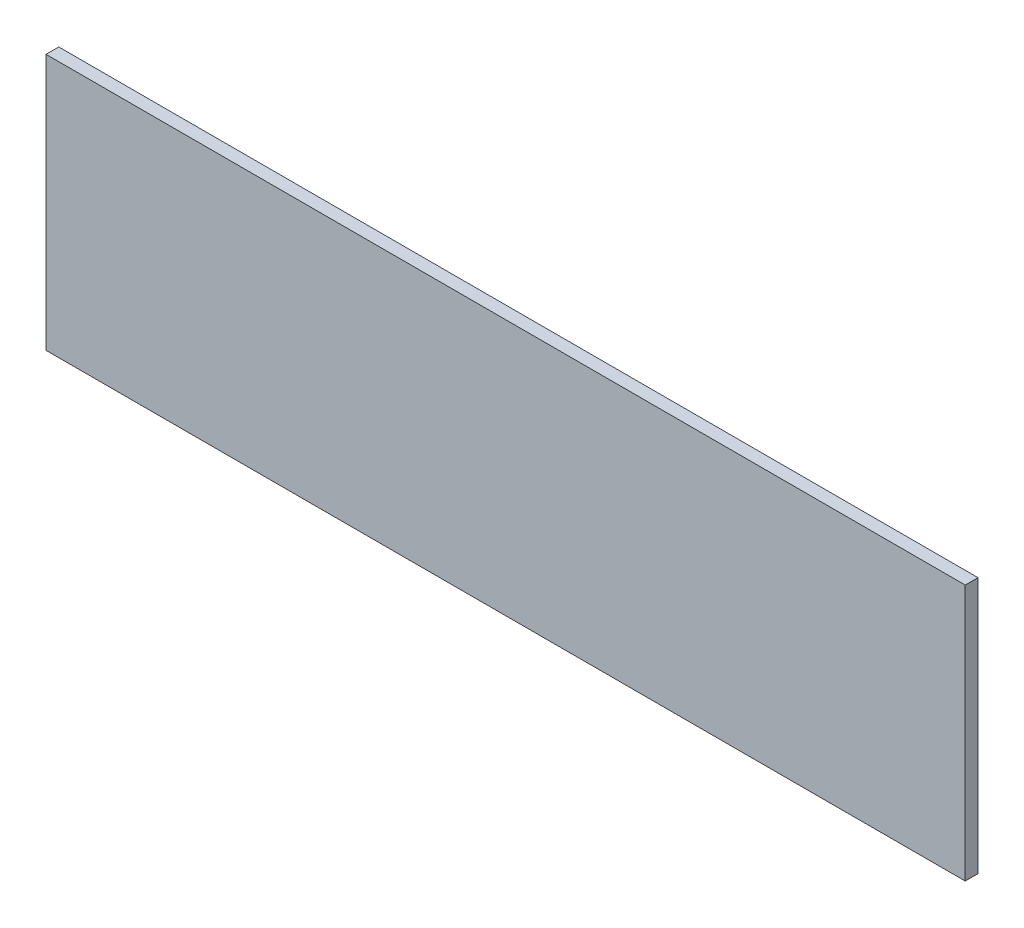
from build123d import *

# Parameters (mm, degrees)
SKETCH1_W          = 228.6
SKETCH1_H          = 63.754
BASE_EXTRUDE_DEPTH = 3.175


with BuildPart() as part:
    # Sketch1 → Base Extrude (new body)
    with BuildSketch(Plane.XY):
        with Locations((114.3, -31.877)):
            Rectangle(SKETCH1_W, SKETCH1_H)
    extrude(amount=BASE_EXTRUDE_DEPTH)


solid = part.part
